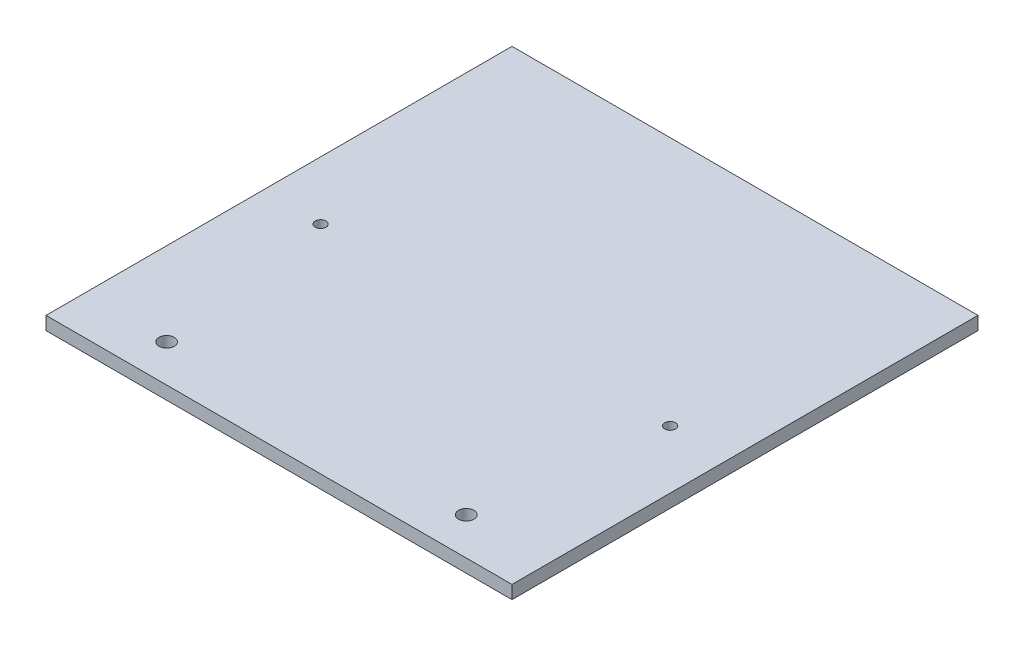
from build123d import *

# Parameters (mm, degrees)
ESQUISSE1_W          = 112
ESQUISSE1_H          = 112
BOSS_EXTRU_1_DEPTH   = 3.175
D_GAGEMENT_M41_D     = 3.7
D_GAGEMENT_M41_DEPTH = 3.175
D_GAGEMENT_M41_TIP   = 1.111592145
D_GAGEMENT_M32_D     = 2.6
D_GAGEMENT_M32_DEPTH = 3.175
D_GAGEMENT_M32_TIP   = 0.781118805


with BuildPart() as part:
    # Esquisse1 → Boss.-Extru.1 (new body)
    with BuildSketch(Plane(origin=(0, 0, 0), x_dir=(1, 0, 0), z_dir=(0, 1, 0))):
        Rectangle(ESQUISSE1_W, ESQUISSE1_H)
    extrude(amount=BOSS_EXTRU_1_DEPTH)

    # Dégagement M41
    with Locations(Plane(origin=(0, 3.175, 0), x_dir=(1, 0, 0), z_dir=(0, 1, 0))):
        with Locations((-36, -47), (36, -47)):
            Hole(D_GAGEMENT_M41_D / 2, depth=D_GAGEMENT_M41_DEPTH)
            with Locations((0, 0, -(D_GAGEMENT_M41_DEPTH + D_GAGEMENT_M41_TIP / 2))):  # 118° drill point
                Cone(0, D_GAGEMENT_M41_D / 2, D_GAGEMENT_M41_TIP, mode=Mode.SUBTRACT)

    # Dégagement M32
    with Locations(Plane(origin=(0, 3.175, 0), x_dir=(1, 0, 0), z_dir=(0, 1, 0))):
        with Locations((42, -4), (-42, -4)):
            Hole(D_GAGEMENT_M32_D / 2, depth=D_GAGEMENT_M32_DEPTH)
            with Locations((0, 0, -(D_GAGEMENT_M32_DEPTH + D_GAGEMENT_M32_TIP / 2))):  # 118° drill point
                Cone(0, D_GAGEMENT_M32_D / 2, D_GAGEMENT_M32_TIP, mode=Mode.SUBTRACT)


solid = part.part
